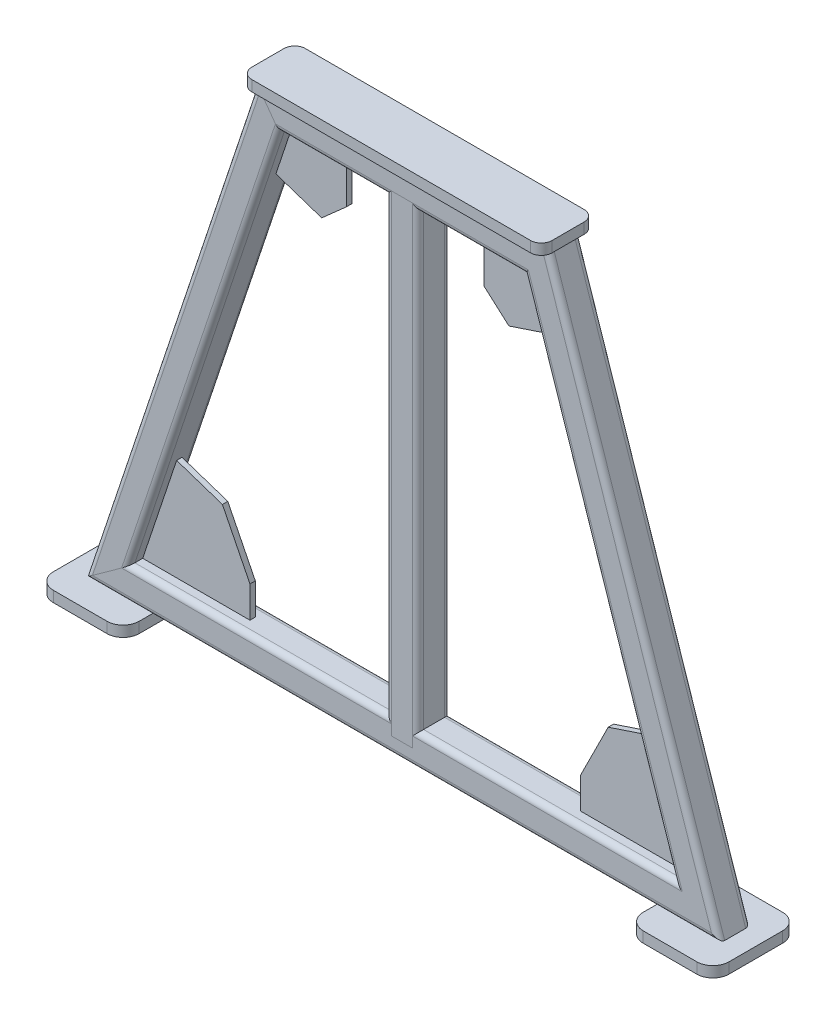
from build123d import *

# Parameters (mm, degrees)
SQUARE_TUBE_30_X_30_X_2_6_1_DEPTH      = 504.773396612
SQUARE_TUBE_30_X_30_X_2_6_1_DEPTH_BACK = 16.289611963
SQUARE_TUBE_30_X_30_X_2_6_1_2_DEPTH    = 610.863495174
SQUARE_TUBE_30_X_30_X_2_6_1_3_DEPTH    = 521.063008575
SQUARE_TUBE_30_X_30_X_2_6_1_4_DEPTH    = 282.579223926
BOSS_EXTRUDE1_DEPTH                    = 10
BOSS_EXTRUDE1_2_DEPTH                  = 10
BOSS_EXTRUDE2_DEPTH                    = 10
GUSSET1_START                          = -2.5
GUSSET1_DEPTH                          = 5
GUSSET2_START                          = -2.5
GUSSET2_DEPTH                          = 5
SQUARE_TUBE_30_X_30_X_2_6_2_DEPTH      = 450


# Read off the part's stored shape, not the designer's step: Gusset1, Gusset2
with BuildPart() as part:
    # Sketch11 → Square tube 30 X 30 X 2.6(1) (new, two sides: drawn at the far end of the back side and taken through both)
    with BuildSketch(Plane(origin=(-125, 450, 0), x_dir=(0.9486832980505138, -0.3162277660168379, 0), z_dir=(-0.31622776601683794, -0.9486832980505139, 0)).offset(-SQUARE_TUBE_30_X_30_X_2_6_1_DEPTH_BACK)):
        with BuildLine():
            Line((-9.8, -15), (9.8, -15))
            ThreePointArc((9.8, -15), (13.476955262, -13.476955262), (15, -9.8))
            Line((15, -9.8), (15, 9.8))
            ThreePointArc((15, 9.8), (13.476955262, 13.476955262), (9.8, 15))
            Line((9.8, 15), (-9.8, 15))
            ThreePointArc((-9.8, 15), (-13.476955262, 13.476955262), (-15, 9.8))
            Line((-15, 9.8), (-15, -9.8))
            ThreePointArc((-15, -9.8), (-13.476955262, -13.476955262), (-9.8, -15))
        make_face()
        with BuildLine():
            Line((-9.8, -12.4), (9.8, -12.4))
            ThreePointArc((9.8, -12.4), (11.638477631, -11.638477631), (12.4, -9.8))
            Line((12.4, -9.8), (12.4, 9.8))
            ThreePointArc((12.4, 9.8), (11.638477631, 11.638477631), (9.8, 12.4))
            Line((9.8, 12.4), (-9.8, 12.4))
            ThreePointArc((-9.8, 12.4), (-11.638477631, 11.638477631), (-12.4, 9.8))
            Line((-12.4, 9.8), (-12.4, -9.8))
            ThreePointArc((-12.4, -9.8), (-11.638477631, -11.638477631), (-9.8, -12.4))
        make_face(mode=Mode.SUBTRACT)
    extrude(amount=SQUARE_TUBE_30_X_30_X_2_6_1_DEPTH + SQUARE_TUBE_30_X_30_X_2_6_1_DEPTH_BACK)

    # Square tube 30 X 30 X 2.6(1) mitre 1
    split(bisect_by=Plane(origin=(-125, 450, 0), x_dir=(0.584710285, -0.811242185, 0), z_dir=(-0.811242185, -0.584710285, 0)), keep=Keep.TOP)

    # Square tube 30 X 30 X 2.6(1) mitre 2
    split(bisect_by=Plane(origin=(-275, 0, 0), x_dir=(-0.811242185, -0.584710285, 0), z_dir=(-0.584710285, 0.811242185, 0)), keep=Keep.TOP)


with BuildPart() as body_2:
    # Sketch11 on segment 2 (carried to segment 2) → Square tube 30 X 30 X 2.6_1 2 (new body)
    with BuildSketch(Plane.YZ.offset(-305.431747587)):
        with BuildLine():
            Line((-9.8, -15), (9.8, -15))
            ThreePointArc((9.8, -15), (13.476955262, -13.476955262), (15, -9.8))
            Line((15, -9.8), (15, 9.8))
            ThreePointArc((15, 9.8), (13.476955262, 13.476955262), (9.8, 15))
            Line((9.8, 15), (-9.8, 15))
            ThreePointArc((-9.8, 15), (-13.476955262, 13.476955262), (-15, 9.8))
            Line((-15, 9.8), (-15, -9.8))
            ThreePointArc((-15, -9.8), (-13.476955262, -13.476955262), (-9.8, -15))
        make_face()
        with BuildLine():
            Line((-9.8, -12.4), (9.8, -12.4))
            ThreePointArc((9.8, -12.4), (11.638477631, -11.638477631), (12.4, -9.8))
            Line((12.4, -9.8), (12.4, 9.8))
            ThreePointArc((12.4, 9.8), (11.638477631, 11.638477631), (9.8, 12.4))
            Line((9.8, 12.4), (-9.8, 12.4))
            ThreePointArc((-9.8, 12.4), (-11.638477631, 11.638477631), (-12.4, 9.8))
            Line((-12.4, 9.8), (-12.4, -9.8))
            ThreePointArc((-12.4, -9.8), (-11.638477631, -11.638477631), (-9.8, -12.4))
        make_face(mode=Mode.SUBTRACT)
    extrude(amount=SQUARE_TUBE_30_X_30_X_2_6_1_2_DEPTH)

    # Square tube 30 X 30 X 2.6_1 2 mitre 1
    split(bisect_by=Plane(origin=(-275, 0, 0), x_dir=(0.811242185, 0.584710285, 0), z_dir=(0.584710285, -0.811242185, 0)), keep=Keep.TOP)

    # Square tube 30 X 30 X 2.6_1 2 mitre 2
    split(bisect_by=Plane(origin=(275, 0, 0), x_dir=(0.811242185, -0.584710285, 0), z_dir=(-0.584710285, -0.811242185, 0)), keep=Keep.TOP)


with BuildPart() as body_3:
    # Sketch11 on segment 3 (carried to segment 3) → Square tube 30 X 30 X 2.6_1 3 (new body)
    with BuildSketch(Plane(origin=(284.623363555, -28.870090666, 0), x_dir=(-0.948683298, -0.316227766, 0), z_dir=(-0.316227766, 0.948683298, 0))):
        with BuildLine():
            Line((-9.8, -15), (9.8, -15))
            ThreePointArc((9.8, -15), (13.476955262, -13.476955262), (15, -9.8))
            Line((15, -9.8), (15, 9.8))
            ThreePointArc((15, 9.8), (13.476955262, 13.476955262), (9.8, 15))
            Line((9.8, 15), (-9.8, 15))
            ThreePointArc((-9.8, 15), (-13.476955262, 13.476955262), (-15, 9.8))
            Line((-15, 9.8), (-15, -9.8))
            ThreePointArc((-15, -9.8), (-13.476955262, -13.476955262), (-9.8, -15))
        make_face()
        with BuildLine():
            Line((-9.8, -12.4), (9.8, -12.4))
            ThreePointArc((9.8, -12.4), (11.638477631, -11.638477631), (12.4, -9.8))
            Line((12.4, -9.8), (12.4, 9.8))
            ThreePointArc((12.4, 9.8), (11.638477631, 11.638477631), (9.8, 12.4))
            Line((9.8, 12.4), (-9.8, 12.4))
            ThreePointArc((-9.8, 12.4), (-11.638477631, 11.638477631), (-12.4, 9.8))
            Line((-12.4, 9.8), (-12.4, -9.8))
            ThreePointArc((-12.4, -9.8), (-11.638477631, -11.638477631), (-9.8, -12.4))
        make_face(mode=Mode.SUBTRACT)
    extrude(amount=SQUARE_TUBE_30_X_30_X_2_6_1_3_DEPTH)

    # Square tube 30 X 30 X 2.6_1 3 mitre 1
    split(bisect_by=Plane(origin=(275, 0, 0), x_dir=(-0.811242185, 0.584710285, 0), z_dir=(0.584710285, 0.811242185, 0)), keep=Keep.TOP)

    # Square tube 30 X 30 X 2.6_1 3 mitre 2
    split(bisect_by=Plane(origin=(125, 450, 0), x_dir=(0.584710285, 0.811242185, 0), z_dir=(0.811242185, -0.584710285, 0)), keep=Keep.TOP)


with BuildPart() as body_4:
    # Sketch11 on segment 4 (carried to segment 4) → Square tube 30 X 30 X 2.6_1 4 (new body)
    with BuildSketch(Plane(origin=(141.289611963, 450, 0), x_dir=(0, -1, 0), z_dir=(-1, 0, 0))):
        with BuildLine():
            Line((-9.8, -15), (9.8, -15))
            ThreePointArc((9.8, -15), (13.476955262, -13.476955262), (15, -9.8))
            Line((15, -9.8), (15, 9.8))
            ThreePointArc((15, 9.8), (13.476955262, 13.476955262), (9.8, 15))
            Line((9.8, 15), (-9.8, 15))
            ThreePointArc((-9.8, 15), (-13.476955262, 13.476955262), (-15, 9.8))
            Line((-15, 9.8), (-15, -9.8))
            ThreePointArc((-15, -9.8), (-13.476955262, -13.476955262), (-9.8, -15))
        make_face()
        with BuildLine():
            Line((-9.8, -12.4), (9.8, -12.4))
            ThreePointArc((9.8, -12.4), (11.638477631, -11.638477631), (12.4, -9.8))
            Line((12.4, -9.8), (12.4, 9.8))
            ThreePointArc((12.4, 9.8), (11.638477631, 11.638477631), (9.8, 12.4))
            Line((9.8, 12.4), (-9.8, 12.4))
            ThreePointArc((-9.8, 12.4), (-11.638477631, 11.638477631), (-12.4, 9.8))
            Line((-12.4, 9.8), (-12.4, -9.8))
            ThreePointArc((-12.4, -9.8), (-11.638477631, -11.638477631), (-9.8, -12.4))
        make_face(mode=Mode.SUBTRACT)
    extrude(amount=SQUARE_TUBE_30_X_30_X_2_6_1_4_DEPTH)

    # Square tube 30 X 30 X 2.6_1 4 mitre 1
    split(bisect_by=Plane(origin=(125, 450, 0), x_dir=(-0.584710285, -0.811242185, 0), z_dir=(-0.811242185, 0.584710285, 0)), keep=Keep.TOP)

    # Square tube 30 X 30 X 2.6_1 4 mitre 2
    split(bisect_by=Plane(origin=(-125, 450, 0), x_dir=(-0.584710285, 0.811242185, 0), z_dir=(0.811242185, 0.584710285, 0)), keep=Keep.TOP)


with BuildPart() as body_5:
    # Sketch12 → Boss-Extrude1 (new body)
    with BuildSketch(Plane.XZ.offset(15)):
        with BuildLine():
            Line((-300, 40), (-250, 40))
            ThreePointArc((-250, 40), (-239.393398282, 35.606601718), (-235, 25))
            Line((-235, 25), (-235, -25))
            ThreePointArc((-235, -25), (-239.393398282, -35.606601718), (-250, -40))
            Line((-250, -40), (-300, -40))
            ThreePointArc((-300, -40), (-310.606601718, -35.606601718), (-315, -25))
            Line((-315, -25), (-315, 25))
            ThreePointArc((-315, 25), (-310.606601718, 35.606601718), (-300, 40))
        make_face()
    extrude(amount=BOSS_EXTRUDE1_DEPTH)


with BuildPart() as body_6:
    # Sketch12 → Boss-Extrude1 2 (new body)
    with BuildSketch(Plane.XZ.offset(15)):
        with BuildLine():
            Line((250, 40), (300, 40))
            ThreePointArc((300, 40), (310.606601718, 35.606601718), (315, 25))
            Line((315, 25), (315, -25))
            ThreePointArc((315, -25), (310.606601718, -35.606601718), (300, -40))
            Line((300, -40), (250, -40))
            ThreePointArc((250, -40), (239.393398282, -35.606601718), (235, -25))
            Line((235, -25), (235, 25))
            ThreePointArc((235, 25), (239.393398282, 35.606601718), (250, 40))
        make_face()
    extrude(amount=BOSS_EXTRUDE1_2_DEPTH)


with BuildPart() as body_7:
    # Sketch13 → Boss-Extrude2 (new body)
    with BuildSketch(Plane(origin=(0, 465, 0), x_dir=(1, 0, 0), z_dir=(0, 1, 0))):
        with BuildLine():
            Line((-130, 25), (130, 25))
            ThreePointArc((130, 25), (137.071067812, 22.071067812), (140, 15))
            Line((140, 15), (140, -15))
            ThreePointArc((140, -15), (137.071067812, -22.071067812), (130, -25))
            Line((130, -25), (-130, -25))
            ThreePointArc((-130, -25), (-137.071067812, -22.071067812), (-140, -15))
            Line((-140, -15), (-140, 15))
            ThreePointArc((-140, 15), (-137.071067812, 22.071067812), (-130, 25))
        make_face()
    extrude(amount=BOSS_EXTRUDE2_DEPTH)


with BuildPart() as body_8:
    # Gusset1 outline → Gusset1 (new body)
    with BuildSketch(Plane.XY.offset(GUSSET1_START)):
        Polygon((-179.875086685, 95.638080334), (-222.565835097, 109.868329805), (-254.188611699, 15), (-154.188611699, 15), (-154.188611699, 44.265130362), align=None)
    gusset1 = extrude(amount=GUSSET1_DEPTH)


with BuildPart() as body_9:
    # Gusset2 outline → Gusset2 (new body)
    with BuildSketch(Plane.XY.offset(GUSSET2_START)):
        Polygon((-130, 387.565835097), (-87.309251588, 373.335585627), (-64.188611699, 393.837844167), (-64.188611699, 435), (-114.188611699, 435), align=None)
    gusset2 = extrude(amount=GUSSET2_DEPTH)


with BuildPart() as body_2_1:
    add(body_2.part)

    add(body_3.part)  # Mirror1 merges body 3

    add(body_4.part)  # Mirror1 merges body 4
    # Mirror1: Gusset1, Gusset2 across plane
    add(gusset1.mirror(Plane(origin=(0, 0, 0), x_dir=(0, 0, 1), z_dir=(1, 0, 0))))
    add(gusset2.mirror(Plane(origin=(0, 0, 0), x_dir=(0, 0, 1), z_dir=(1, 0, 0))))


with BuildPart() as body_8_2:
    # Sketch141 → Square tube 30 X 30 X 2.6(2) (new body)
    with BuildSketch(Plane.XZ.offset(-450)):
        with BuildLine():
            Line((-9.8, -15), (9.8, -15))
            ThreePointArc((9.8, -15), (13.476955262, -13.476955262), (15, -9.8))
            Line((15, -9.8), (15, 9.8))
            ThreePointArc((15, 9.8), (13.476955262, 13.476955262), (9.8, 15))
            Line((9.8, 15), (-9.8, 15))
            ThreePointArc((-9.8, 15), (-13.476955262, 13.476955262), (-15, 9.8))
            Line((-15, 9.8), (-15, -9.8))
            ThreePointArc((-15, -9.8), (-13.476955262, -13.476955262), (-9.8, -15))
        make_face()
        with BuildLine():
            Line((-9.8, -12.4), (9.8, -12.4))
            ThreePointArc((9.8, -12.4), (11.638477631, -11.638477631), (12.4, -9.8))
            Line((12.4, -9.8), (12.4, 9.8))
            ThreePointArc((12.4, 9.8), (11.638477631, 11.638477631), (9.8, 12.4))
            Line((9.8, 12.4), (-9.8, 12.4))
            ThreePointArc((-9.8, 12.4), (-11.638477631, 11.638477631), (-12.4, 9.8))
            Line((-12.4, 9.8), (-12.4, -9.8))
            ThreePointArc((-12.4, -9.8), (-11.638477631, -11.638477631), (-9.8, -12.4))
        make_face(mode=Mode.SUBTRACT)
    extrude(amount=SQUARE_TUBE_30_X_30_X_2_6_2_DEPTH)


solid = Compound([part.part, body_5.part, body_6.part, body_7.part, body_8.part, body_9.part, body_2_1.part, body_8_2.part])
